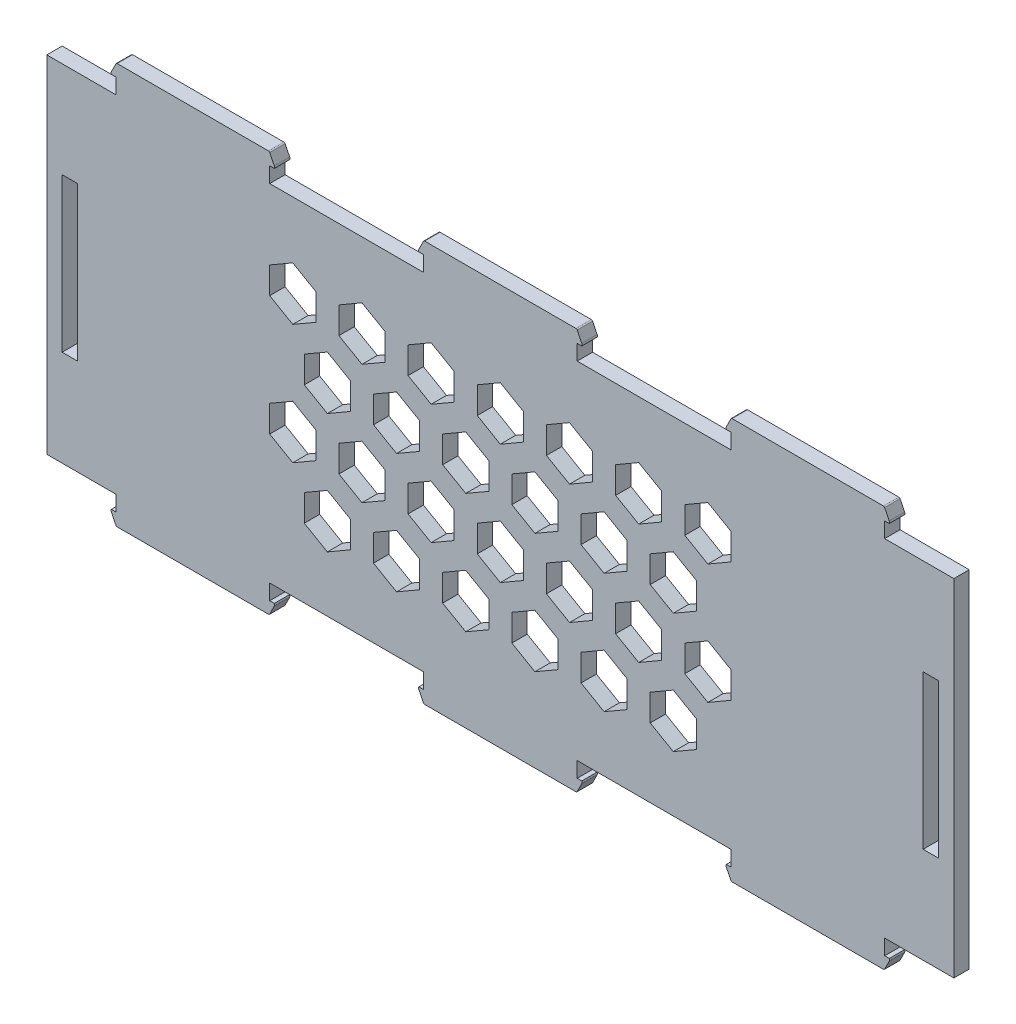
from build123d import *

# Parameters (mm, degrees)
SKETCH1_W           = 2
SKETCH1_H           = 20
BOSS_EXTRUDE1_DEPTH = 2
CUT_EXTRUDE1_START  = -2
CUT_EXTRUDE1_DEPTH  = 2


# Read off the part's stored shape, not the designer's step: Cut-Extrude1
with BuildPart() as part:
    # Sketch1 → Boss-Extrude1 (new body)
    with BuildSketch(Plane.XY):
        with BuildLine():
            Line((0, 0), (5, 0))
            Line((5, 0), (5, -2))
            Line((5, -2), (4.4, -2))
            ThreePointArc((4.4, -2), (4.364589803, -2.15), (4.4, -2.3))
            Line((4.4, -2.3), (5, -3.5))
            ThreePointArc((5, -3.5), (5.066697747, -3.572982477), (5.161803399, -3.6))
            Line((5.161803399, -3.6), (24.838196601, -3.6))
            ThreePointArc((24.838196601, -3.6), (24.933302253, -3.572982477), (25, -3.5))
            Line((25, -3.5), (25.6, -2.3))
            ThreePointArc((25.6, -2.3), (25.635410197, -2.15), (25.6, -2))
            Line((25.6, -2), (25, -2))
            Line((25, -2), (25, 0))
            Line((25, 0), (45, 0))
            Line((45, 0), (45, -2))
            Line((45, -2), (44.4, -2))
            ThreePointArc((44.4, -2), (44.364589803, -2.15), (44.4, -2.3))
            Line((44.4, -2.3), (45, -3.5))
            ThreePointArc((45, -3.5), (45.066697747, -3.572982477), (45.161803399, -3.6))
            Line((45.161803399, -3.6), (64.838196601, -3.6))
            ThreePointArc((64.838196601, -3.6), (64.933302253, -3.572982477), (65, -3.5))
            Line((65, -3.5), (65.6, -2.3))
            ThreePointArc((65.6, -2.3), (65.635410197, -2.15), (65.6, -2))
            Line((65.6, -2), (65, -2))
            Line((65, -2), (65, 0))
            Line((65, 0), (85, 0))
            Line((85, 0), (85, -2))
            Line((85, -2), (84.4, -2))
            ThreePointArc((84.4, -2), (84.364589803, -2.15), (84.4, -2.3))
            Line((84.4, -2.3), (85, -3.5))
            ThreePointArc((85, -3.5), (85.066697747, -3.572982477), (85.161803399, -3.6))
            Line((85.161803399, -3.6), (104.838196601, -3.6))
            ThreePointArc((104.838196601, -3.6), (104.933302253, -3.572982477), (105, -3.5))
            Line((105, -3.5), (105.6, -2.3))
            ThreePointArc((105.6, -2.3), (105.635410197, -2.15), (105.6, -2))
            Line((105.6, -2), (105, -2))
            Line((105, -2), (105, 0))
            Line((105, 0), (110, 0))
            Line((110, 0), (114, 0))
            Line((114, 0), (114, 45))
            Line((114, 45), (110, 45))
            Line((110, 45), (105, 45))
            Line((105, 45), (105, 47))
            Line((105, 47), (105.6, 47))
            ThreePointArc((105.6, 47), (105.635410197, 47.15), (105.6, 47.3))
            Line((105.6, 47.3), (105, 48.5))
            ThreePointArc((105, 48.5), (104.933302253, 48.572982477), (104.838196601, 48.6))
            Line((104.838196601, 48.6), (85.161803399, 48.6))
            ThreePointArc((85.161803399, 48.6), (85.066697747, 48.572982477), (85, 48.5))
            Line((85, 48.5), (84.4, 47.3))
            ThreePointArc((84.4, 47.3), (84.364589803, 47.15), (84.4, 47))
            Line((84.4, 47), (85, 47))
            Line((85, 47), (85, 45))
            Line((85, 45), (65, 45))
            Line((65, 45), (65, 47))
            Line((65, 47), (65.6, 47))
            ThreePointArc((65.6, 47), (65.635410197, 47.15), (65.6, 47.3))
            Line((65.6, 47.3), (65, 48.5))
            ThreePointArc((65, 48.5), (64.933302253, 48.572982477), (64.838196601, 48.6))
            Line((64.838196601, 48.6), (45.161803399, 48.6))
            ThreePointArc((45.161803399, 48.6), (45.066697747, 48.572982477), (45, 48.5))
            Line((45, 48.5), (44.4, 47.3))
            ThreePointArc((44.4, 47.3), (44.364589803, 47.15), (44.4, 47))
            Line((44.4, 47), (45, 47))
            Line((45, 47), (45, 45))
            Line((45, 45), (25, 45))
            Line((25, 45), (25, 47))
            Line((25, 47), (25.6, 47))
            ThreePointArc((25.6, 47), (25.635410197, 47.15), (25.6, 47.3))
            Line((25.6, 47.3), (25, 48.5))
            ThreePointArc((25, 48.5), (24.933302253, 48.572982477), (24.838196601, 48.6))
            Line((24.838196601, 48.6), (5.161803399, 48.6))
            ThreePointArc((5.161803399, 48.6), (5.066697747, 48.572982477), (5, 48.5))
            Line((5, 48.5), (4.4, 47.3))
            ThreePointArc((4.4, 47.3), (4.364589803, 47.15), (4.4, 47))
            Line((4.4, 47), (5, 47))
            Line((5, 47), (5, 45))
            Line((5, 45), (0, 45))
            Line((0, 45), (-4, 45))
            Line((-4, 45), (-4, 0))
            Line((-4, 0), (0, 0))
        make_face()
        with Locations((-1, 22.5)):
            Rectangle(SKETCH1_W, SKETCH1_H, mode=Mode.SUBTRACT)
        with Locations((111, 22.5)):
            Rectangle(SKETCH1_W, SKETCH1_H, mode=Mode.SUBTRACT)
    extrude(amount=BOSS_EXTRUDE1_DEPTH)

    # Cut-Extrude1 outline → Cut-Extrude1 (cut)
    with BuildSketch(Plane.XY.offset(2).offset(CUT_EXTRUDE1_START)):
        Polygon((28, 37.566882219), (25, 35.834831411), (25, 32.370729796), (28, 30.638678989), (31, 32.370729796), (31, 35.834831411), align=None)
        Polygon((28, 21.978424951), (25, 20.246374143), (25, 16.782272528), (28, 15.050221721), (31, 16.782272528), (31, 20.246374143), align=None)
        Polygon((82, 15.050221721), (85, 16.782272528), (85, 20.246374143), (82, 21.978424951), (79, 20.246374143), (79, 16.782272528), align=None)
        Polygon((82, 30.638678989), (85, 32.370729796), (85, 35.834831411), (82, 37.566882219), (79, 35.834831411), (79, 32.370729796), align=None)
        Polygon((40, 32.370729796), (40, 35.834831411), (37, 37.566882219), (34, 35.834831411), (34, 32.370729796), (37, 30.638678989), align=None)
        Polygon((67, 16.782272528), (67, 20.246374143), (64, 21.978424951), (61, 20.246374143), (61, 16.782272528), (64, 15.050221721), align=None)
        Polygon((80.5, 8.988043894), (80.5, 12.452145509), (77.5, 14.184196317), (74.5, 12.452145509), (74.5, 8.988043894), (77.5, 7.255993087), align=None)
        Polygon((53.5, 24.576501162), (53.5, 28.040602777), (50.5, 29.772653585), (47.5, 28.040602777), (47.5, 24.576501162), (50.5, 22.844450355), align=None)
        Polygon((37, 15.050221721), (40, 16.782272528), (40, 20.246374143), (37, 21.978424951), (34, 20.246374143), (34, 16.782272528), align=None)
        Polygon((64, 30.638678989), (67, 32.370729796), (67, 35.834831411), (64, 37.566882219), (61, 35.834831411), (61, 32.370729796), align=None)
        Polygon((47.5, 8.988043894), (50.5, 7.255993087), (53.5, 8.988043894), (53.5, 12.452145509), (50.5, 14.184196317), (47.5, 12.452145509), align=None)
        Polygon((74.5, 24.576501162), (77.5, 22.844450355), (80.5, 24.576501162), (80.5, 28.040602777), (77.5, 29.772653585), (74.5, 28.040602777), align=None)
        Polygon((71.5, 8.988043894), (71.5, 12.452145509), (68.5, 14.184196317), (65.5, 12.452145509), (65.5, 8.988043894), (68.5, 7.255993087), align=None)
        Polygon((58, 16.782272528), (58, 20.246374143), (55, 21.978424951), (52, 20.246374143), (52, 16.782272528), (55, 15.050221721), align=None)
        Polygon((44.5, 24.576501162), (44.5, 28.040602777), (41.5, 29.772653585), (38.5, 28.040602777), (38.5, 24.576501162), (41.5, 22.844450355), align=None)
        Polygon((68.5, 22.844450355), (71.5, 24.576501162), (71.5, 28.040602777), (68.5, 29.772653585), (65.5, 28.040602777), (65.5, 24.576501162), align=None)
        Polygon((76, 16.782272528), (76, 20.246374143), (73, 21.978424951), (70, 20.246374143), (70, 16.782272528), (73, 15.050221721), align=None)
        Polygon((62.5, 24.576501162), (62.5, 28.040602777), (59.5, 29.772653585), (56.5, 28.040602777), (56.5, 24.576501162), (59.5, 22.844450355), align=None)
        Polygon((49, 32.370729796), (49, 35.834831411), (46, 37.566882219), (43, 35.834831411), (43, 32.370729796), (46, 30.638678989), align=None)
        Polygon((73, 30.638678989), (76, 32.370729796), (76, 35.834831411), (73, 37.566882219), (70, 35.834831411), (70, 32.370729796), align=None)
        Polygon((56.5, 8.988043894), (59.5, 7.255993087), (62.5, 8.988043894), (62.5, 12.452145509), (59.5, 14.184196317), (56.5, 12.452145509), align=None)
        Polygon((49, 16.782272528), (49, 20.246374143), (46, 21.978424951), (43, 20.246374143), (43, 16.782272528), (46, 15.050221721), align=None)
        Polygon((35.5, 24.576501162), (35.5, 28.040602777), (32.5, 29.772653585), (29.5, 28.040602777), (29.5, 24.576501162), (32.5, 22.844450355), align=None)
        Polygon((29.5, 8.988043894), (32.5, 7.255993087), (35.5, 8.988043894), (35.5, 12.452145509), (32.5, 14.184196317), (29.5, 12.452145509), align=None)
        Polygon((55, 30.638678989), (58, 32.370729796), (58, 35.834831411), (55, 37.566882219), (52, 35.834831411), (52, 32.370729796), align=None)
        Polygon((38.5, 8.988043894), (41.5, 7.255993087), (44.5, 8.988043894), (44.5, 12.452145509), (41.5, 14.184196317), (38.5, 12.452145509), align=None)
    extrude(amount=CUT_EXTRUDE1_DEPTH, mode=Mode.SUBTRACT)


solid = part.part
